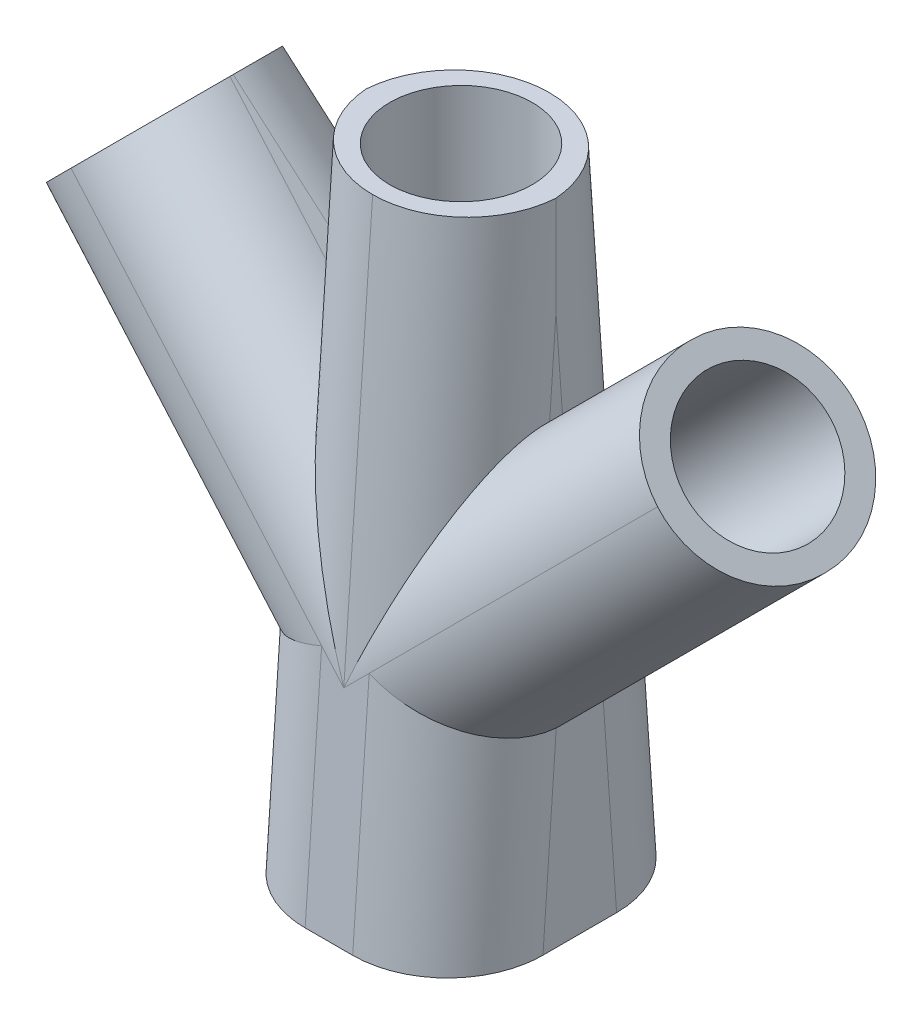
from build123d import *

# Parameters (mm, degrees)
EXTRUDE_618_DEPTH           = 12.5
SKETCH_4_R                  = 3.75
CUT_EXTRUDE_975_DEPTH       = 41.05700865176058
CUT_EXTRUDE_1125_REACH      = 47.49
CUT_EXTRUDE_1125_END_RADIUS = 3.75
SKETCH_5_R                  = 3.749999999999998
SKETCH_9_R                  = 5.25
CUT_EXTRUDE_1299_DEPTH      = 8
DRAFT_2_ANGLE               = 4.000000000000009
FILLET_8_R                  = 5


with BuildPart() as part:
    # Эскиз3 → Extrude 618 (new body)
    with BuildSketch(Plane.XY):
        Polygon((-6.249999999999994, 0), (-19.142135623730994, 12.892135623731), (-12.071067811865465, 19.963203435596466), (-5.000000000000028, 12.892135623730955), (-5.000000000000029, 22.892135623730955), (4.9999999999999964, 22.892135623730955), (5.000000000000001, 12.892135623730955), (12.071067811865465, 19.96320343559647), (19.142135623730994, 12.892135623731003), (6.249999999999991, 1.73e-15), (6.2499999999999964, -10.000000000000002), (-6.2499999999999885, -10.000000000000004), align=None)
    extrude(amount=EXTRUDE_618_DEPTH)

    # Эскиз4 → Cut-Extrude 975 (cut, through all)
    with BuildSketch(Plane(origin=(0, 22.892135623730955, 0), x_dir=(-1, 0, 0), z_dir=(0, 1, 0))):
        with Locations(Location((0, 6.25, 0), (0, 0, 90))):
            Circle(SKETCH_4_R)
    extrude(amount=-CUT_EXTRUDE_975_DEPTH, mode=Mode.SUBTRACT)

    # Cut-Extrude 1125: up to this cylinder (the profile starts outside it)
    cut_extrude_1125_end = Plane(origin=(0, 16.42767, 6.25), z_dir=(0, 1, 0)) * Cylinder(CUT_EXTRUDE_1125_END_RADIUS, 103.48, mode=Mode.PRIVATE)
    # Эскиз5 → Cut-Extrude 1125 (cut, up to the surface)
    with BuildSketch(Plane(origin=(-16.017135623730912, 16.01713562373106, 0), x_dir=(0, 0, 1), z_dir=(-0.707106781186544, 0.7071067811865511, 0)), mode=Mode.PRIVATE) as cut_extrude_1125_sk1:
        with Locations(Location((6.25, 0.5805826175839922, 0), (0, 0, 270))):
            Circle(SKETCH_5_R)
    cut_extrude_1125_tool1 = extrude(cut_extrude_1125_sk1.sketch, amount=-CUT_EXTRUDE_1125_REACH, mode=Mode.PRIVATE) - cut_extrude_1125_end
    cut_extrude_1125 = cut_extrude_1125_tool1.solids().sort_by_distance((-15.606602, 16.42767, 6.25))[0]
    add(cut_extrude_1125, mode=Mode.SUBTRACT)

    # Зеркальное отражение1: Cut-Extrude 1125 across plane
    add(cut_extrude_1125.mirror(Plane(origin=(0, 0, 0), x_dir=(0, 0, 1), z_dir=(1, 0, 0))), mode=Mode.SUBTRACT)

    # Эскиз9 → Cut-Extrude 1299 (cut)
    with BuildSketch(Plane.XZ.offset(10.000000000000004)):
        with Locations((-1.39e-15, 6.25)):
            Circle(SKETCH_9_R)
    extrude(amount=-CUT_EXTRUDE_1299_DEPTH, mode=Mode.SUBTRACT)

    # Уклон2
    draft_2_faces = [part.faces().sort_by_distance(p)[0] for p in [
        (-4.1e-16, 7.904291120407681, 0),
        (-4.1e-16, 7.904291120407681, 12.5),
    ]]
    draft(draft_2_faces, Plane.ZX, DRAFT_2_ANGLE)

    # Скругление8
    # the kernel refuses this fillet: 5 mm, written as the material it takes off along each edge
    with BuildSketch(Plane(origin=(-3.4028318124765566, 4.489303811254336, 0.313922703366867), x_dir=(0.707968543318461, -0.7045235927201029, -0.049265088777904954), z_dir=(0.7062439675293066, 0.7062439675293118, 0.04938538910366094))) as fillet_8_piece_1_section:
        with BuildLine():
            CenterArc((FILLET_8_R * 0.951833326591, -FILLET_8_R), FILLET_8_R, 90.00000000000001, 87.17272263971289)
            Line((-FILLET_8_R * 0.0469494411747, -FILLET_8_R * 0.950674724384), (-FILLET_8_R * 0.06692509653, -FILLET_8_R * 0.949688218872))
            Line((-FILLET_8_R * 0.06692509653, -FILLET_8_R * 0.949688218872), (-FILLET_8_R * 0.0190366665318, FILLET_8_R * 0.02))
            Line((-FILLET_8_R * 0.0190366665318, FILLET_8_R * 0.02), (FILLET_8_R * 0.951833326591, FILLET_8_R * 0.02))
            Line((FILLET_8_R * 0.951833326591, FILLET_8_R * 0.02), (FILLET_8_R * 0.951833326591, 0))
        make_face()
    fillet_8_piece_1 = extrude(amount=33.808050099667255, mode=Mode.PRIVATE)
    fillet_8_piece_1 = split(fillet_8_piece_1, bisect_by=Plane(origin=(12.895577990710061, 19.13869325675188, 2.0784184660423826), z_dir=(-0.7071067811865445, -0.7071067811865507, 0)), keep=Keep.TOP, mode=Mode.PRIVATE)
    fillet_8_piece_1 = split(fillet_8_piece_1, bisect_by=Plane(origin=(5, 15.19090426134115, 2.0784184660423826), z_dir=(1, 4.4e-16, 0)), keep=Keep.TOP, mode=Mode.PRIVATE)
    add(fillet_8_piece_1, mode=Mode.SUBTRACT)
    with BuildSketch(Plane(origin=(4.999999999999991, 35.36168625197875, 2.4727299845475397), x_dir=(-1, -4.4e-16, -1.3e-16), z_dir=(0, -0.9975640502598243, -0.06975647374412541))) as fillet_8_piece_2_section:
        with BuildLine():
            CenterArc((FILLET_8_R, -FILLET_8_R), FILLET_8_R, 89.99999999999999, 90.00000000000001)
            Line((-1.38e-15, -FILLET_8_R), (-FILLET_8_R * 0.02, -FILLET_8_R))
            Line((-FILLET_8_R * 0.02, -FILLET_8_R), (-FILLET_8_R * 0.02, FILLET_8_R * 0.02))
            Line((-FILLET_8_R * 0.02, FILLET_8_R * 0.02), (FILLET_8_R, FILLET_8_R * 0.02))
            Line((FILLET_8_R, FILLET_8_R * 0.02), (FILLET_8_R, 0))
        make_face()
    fillet_8_piece_2 = extrude(amount=35.02441898081172, mode=Mode.PRIVATE)
    fillet_8_piece_2 = split(fillet_8_piece_2, bisect_by=Plane(origin=(3.7636479953298396, 22.892135623730955, 2.280840284876604), z_dir=(0, -1, 0)), keep=Keep.TOP, mode=Mode.PRIVATE)
    fillet_8_piece_2 = split(fillet_8_piece_2, bisect_by=Plane(origin=(6.5727359964244485, 14.464871620155414, 2.280840284876604), z_dir=(-0.7071067811865501, 0.707106781186545, 0)), keep=Keep.TOP, mode=Mode.PRIVATE)
    add(fillet_8_piece_2, mode=Mode.SUBTRACT)
    with BuildSketch(Plane(origin=(-5.0000000000000275, 0.4225849954831524, 0.02955002150929953), x_dir=(1, 9e-17, 5e-17), z_dir=(0, 0.9975640502598243, 0.06975647374412541))) as fillet_8_piece_3_section:
        with BuildLine():
            CenterArc((FILLET_8_R, -FILLET_8_R), FILLET_8_R, 90, 90)
            Line((-6.5e-16, -FILLET_8_R), (-FILLET_8_R * 0.02, -FILLET_8_R))
            Line((-FILLET_8_R * 0.02, -FILLET_8_R), (-FILLET_8_R * 0.02, FILLET_8_R * 0.02))
            Line((-FILLET_8_R * 0.02, FILLET_8_R * 0.02), (FILLET_8_R, FILLET_8_R * 0.02))
            Line((FILLET_8_R, FILLET_8_R * 0.02), (FILLET_8_R, 0))
        make_face()
    fillet_8_piece_3 = extrude(amount=35.02441898081172, mode=Mode.PRIVATE)
    fillet_8_piece_3 = split(fillet_8_piece_3, bisect_by=Plane(origin=(-3.7636479953300457, 22.892135623730955, 2.280840284876456), z_dir=(0, -1, 0)), keep=Keep.TOP, mode=Mode.PRIVATE)
    fillet_8_piece_3 = split(fillet_8_piece_3, bisect_by=Plane(origin=(-6.572735996425691, 14.464871620156634, 2.280840284876456), z_dir=(0.7071067811865512, 0.7071067811865438, 0)), keep=Keep.TOP, mode=Mode.PRIVATE)
    add(fillet_8_piece_3, mode=Mode.SUBTRACT)
    with BuildSketch(Plane(origin=(-20.47389962434201, 28.366035248073096, 1.9835464123749982), x_dir=(-0.707968543318462, -0.7045235927201018, -0.04926508877790491), z_dir=(0.7062439675293055, -0.706243967529313, -0.04938538910366102))) as fillet_8_piece_4_section:
        with BuildLine():
            CenterArc((FILLET_8_R * 0.951833326591, -FILLET_8_R), FILLET_8_R, 90.00000000000001, 87.17272263971292)
            Line((-FILLET_8_R * 0.0469494411747, -FILLET_8_R * 0.950674724384), (-FILLET_8_R * 0.06692509653, -FILLET_8_R * 0.949688218872))
            Line((-FILLET_8_R * 0.06692509653, -FILLET_8_R * 0.949688218872), (-FILLET_8_R * 0.0190366665318, FILLET_8_R * 0.02))
            Line((-FILLET_8_R * 0.0190366665318, FILLET_8_R * 0.02), (FILLET_8_R * 0.951833326591, FILLET_8_R * 0.02))
            Line((FILLET_8_R * 0.951833326591, FILLET_8_R * 0.02), (FILLET_8_R * 0.951833326591, 1e-17))
        make_face()
    fillet_8_piece_4 = extrude(amount=33.808050099667234, mode=Mode.PRIVATE)
    fillet_8_piece_4 = split(fillet_8_piece_4, bisect_by=Plane(origin=(-12.895577990710212, 19.138693256751726, 2.0784184660426637), z_dir=(0.7071067811865444, -0.7071067811865508, 0)), keep=Keep.TOP, mode=Mode.PRIVATE)
    fillet_8_piece_4 = split(fillet_8_piece_4, bisect_by=Plane(origin=(-5.000000000000028, 15.190904261339226, 2.0784184660426637), z_dir=(-1, -9e-17, 0)), keep=Keep.TOP, mode=Mode.PRIVATE)
    add(fillet_8_piece_4, mode=Mode.SUBTRACT)
    with BuildSketch(Plane(origin=(3.024785140940291, -9.274785140940285, -0.6485561563669969), x_dir=(0.034920743526734764, -0.034920743526734764, 0.9987797972241329), z_dir=(-0.7062439675293093, 0.7062439675293093, 0.04938538910366077))) as fillet_8_piece_5_section:
        with BuildLine():
            CenterArc((FILLET_8_R * 1.0506041048, FILLET_8_R), FILLET_8_R, 177.17272263971293, 92.8272773602871)
            Line((FILLET_8_R * 0.0518213370326, FILLET_8_R * 1.04932527562), (FILLET_8_R * 0.0318456816773, FILLET_8_R * 1.05031178113))
            Line((FILLET_8_R * 0.0318456816773, FILLET_8_R * 1.05031178113), (-FILLET_8_R * 0.021012082096, -FILLET_8_R * 0.02))
            Line((-FILLET_8_R * 0.021012082096, -FILLET_8_R * 0.02), (FILLET_8_R * 1.0506041048, -FILLET_8_R * 0.02))
            Line((FILLET_8_R * 1.0506041048, -FILLET_8_R * 0.02), (FILLET_8_R * 1.0506041048, -1e-17))
        make_face()
    fillet_8_piece_5 = extrude(amount=44.519609867402835, mode=Mode.PRIVATE)
    fillet_8_piece_5 = split(fillet_8_piece_5, bisect_by=Plane(origin=(-6.249999999999998, 7.634264741233562, 1.7755717356560854), z_dir=(-1, -5.3e-16, 0)), keep=Keep.TOP, mode=Mode.PRIVATE)
    fillet_8_piece_5 = split(fillet_8_piece_5, bisect_by=Plane(origin=(-18.350004337442122, 13.684266910019865, 1.7755717356560854), z_dir=(0.7071067811865444, -0.7071067811865508, 0)), keep=Keep.TOP, mode=Mode.PRIVATE)
    add(fillet_8_piece_5, mode=Mode.SUBTRACT)
    with BuildSketch(Plane(origin=(-6.249999999999982, -22.469550628247802, -1.5712240412366727), x_dir=(0, -0.06975647374412541, 0.9975640502598242), z_dir=(0, 0.9975640502598243, 0.06975647374412541))) as fillet_8_piece_6_section:
        with BuildLine():
            CenterArc((FILLET_8_R, FILLET_8_R), FILLET_8_R, 180, 90)
            Line((0, FILLET_8_R), (-FILLET_8_R * 0.02, FILLET_8_R))
            Line((-FILLET_8_R * 0.02, FILLET_8_R), (-FILLET_8_R * 0.02, -FILLET_8_R * 0.02))
            Line((-FILLET_8_R * 0.02, -FILLET_8_R * 0.02), (FILLET_8_R, -FILLET_8_R * 0.02))
            Line((FILLET_8_R, -FILLET_8_R * 0.02), (FILLET_8_R, 0))
        make_face()
    fillet_8_piece_6 = extrude(amount=35.02441898081171, mode=Mode.PRIVATE)
    fillet_8_piece_6 = split(fillet_8_piece_6, bisect_by=Plane(origin=(-2.999285634158696, -3.2507143658412976, 0.8277016679449097), z_dir=(-0.7071067811865476, -0.7071067811865476, 0)), keep=Keep.TOP, mode=Mode.PRIVATE)
    fillet_8_piece_6 = split(fillet_8_piece_6, bisect_by=Plane(origin=(-5.249047512261576, -10.000000000000004, 0.8277016679449097), z_dir=(-1.4e-16, 1, 0)), keep=Keep.TOP, mode=Mode.PRIVATE)
    add(fillet_8_piece_6, mode=Mode.SUBTRACT)
    with BuildSketch(Plane(origin=(6.249999999999985, 12.469550628247795, 0.871955921801567), x_dir=(-1, -5.3e-16, -1e-16), z_dir=(0, -0.9975640502598243, -0.06975647374412541))) as fillet_8_piece_7_section:
        with BuildLine():
            CenterArc((FILLET_8_R, -FILLET_8_R), FILLET_8_R, 89.99999999999999, 90.00000000000001)
            Line((-1.19e-15, -FILLET_8_R), (-FILLET_8_R * 0.02, -FILLET_8_R))
            Line((-FILLET_8_R * 0.02, -FILLET_8_R), (-FILLET_8_R * 0.02, FILLET_8_R * 0.02))
            Line((-FILLET_8_R * 0.02, FILLET_8_R * 0.02), (FILLET_8_R, FILLET_8_R * 0.02))
            Line((FILLET_8_R, FILLET_8_R * 0.02), (FILLET_8_R, 0))
        make_face()
    fillet_8_piece_7 = extrude(amount=35.02441898081172, mode=Mode.PRIVATE)
    fillet_8_piece_7 = split(fillet_8_piece_7, bisect_by=Plane(origin=(5.249047512262002, -10.000000000000002, 0.8277016679442836), z_dir=(-1.4e-16, 1, 0)), keep=Keep.TOP, mode=Mode.PRIVATE)
    fillet_8_piece_7 = split(fillet_8_piece_7, bisect_by=Plane(origin=(2.9992856341578893, -3.250714365842102, 0.8277016679442836), z_dir=(0.7071067811865476, -0.7071067811865476, 0)), keep=Keep.TOP, mode=Mode.PRIVATE)
    add(fillet_8_piece_7, mode=Mode.SUBTRACT)
    with BuildSketch(Plane(origin=(28.416920764671282, 22.16692076467129, 1.5500620996778676), x_dir=(-0.7079685433184584, 0.7045235927201055, 0.04926508877790521), z_dir=(-0.7062439675293093, -0.7062439675293093, -0.04938538910366077))) as fillet_8_piece_8_section:
        with BuildLine():
            CenterArc((FILLET_8_R * 1.0506041048, -FILLET_8_R), FILLET_8_R, 90, 92.8272773602871)
            Line((FILLET_8_R * 0.0518213370326, -FILLET_8_R * 1.04932527562), (FILLET_8_R * 0.0318456816773, -FILLET_8_R * 1.05031178113))
            Line((FILLET_8_R * 0.0318456816773, -FILLET_8_R * 1.05031178113), (-FILLET_8_R * 0.021012082096, FILLET_8_R * 0.02))
            Line((-FILLET_8_R * 0.021012082096, FILLET_8_R * 0.02), (FILLET_8_R * 1.0506041048, FILLET_8_R * 0.02))
            Line((FILLET_8_R * 1.0506041048, FILLET_8_R * 0.02), (FILLET_8_R * 1.0506041048, 1e-17))
        make_face()
    fillet_8_piece_8 = extrude(amount=44.519609867402856, mode=Mode.PRIVATE)
    fillet_8_piece_8 = split(fillet_8_piece_8, bisect_by=Plane(origin=(18.350004337441796, 13.684266910020192, 1.7755717356563456), z_dir=(-0.7071067811865445, -0.7071067811865507, 0)), keep=Keep.TOP, mode=Mode.PRIVATE)
    fillet_8_piece_8 = split(fillet_8_piece_8, bisect_by=Plane(origin=(6.249999999999987, 7.634264741230422, 1.7755717356563456), z_dir=(1, 5.3e-16, 0)), keep=Keep.TOP, mode=Mode.PRIVATE)
    add(fillet_8_piece_8, mode=Mode.SUBTRACT)
    with BuildSketch(Plane(origin=(-6.249999999999982, -22.469550628247813, 14.071224041236674), x_dir=(0, -0.06975647374412541, -0.9975640502598242), z_dir=(0, 0.9975640502598243, -0.06975647374412541))) as fillet_8_piece_9_section:
        with BuildLine():
            CenterArc((FILLET_8_R, -FILLET_8_R), FILLET_8_R, 90.00000000000001, 89.99999999999999)
            Line((6.4e-16, -FILLET_8_R), (-FILLET_8_R * 0.02, -FILLET_8_R))
            Line((-FILLET_8_R * 0.02, -FILLET_8_R), (-FILLET_8_R * 0.02, FILLET_8_R * 0.02))
            Line((-FILLET_8_R * 0.02, FILLET_8_R * 0.02), (FILLET_8_R, FILLET_8_R * 0.02))
            Line((FILLET_8_R, FILLET_8_R * 0.02), (FILLET_8_R, 0))
        make_face()
    fillet_8_piece_9 = extrude(amount=35.02441898081173, mode=Mode.PRIVATE)
    fillet_8_piece_9 = split(fillet_8_piece_9, bisect_by=Plane(origin=(-2.9992856341583285, -3.2507143658416653, 11.672298332055412), z_dir=(-0.7071067811865476, -0.7071067811865476, 0)), keep=Keep.TOP, mode=Mode.PRIVATE)
    fillet_8_piece_9 = split(fillet_8_piece_9, bisect_by=Plane(origin=(-5.249047512261512, -10.000000000000004, 11.672298332055412), z_dir=(-1.4e-16, 1, 0)), keep=Keep.TOP, mode=Mode.PRIVATE)
    add(fillet_8_piece_9, mode=Mode.SUBTRACT)
    with BuildSketch(Plane(origin=(6.249999999999985, 12.469550628247802, 11.628044078198434), x_dir=(-1, -5.3e-16, -1e-17), z_dir=(0, -0.9975640502598243, 0.06975647374412541))) as fillet_8_piece_10_section:
        with BuildLine():
            CenterArc((FILLET_8_R, FILLET_8_R), FILLET_8_R, 180, 90)
            Line((-6.4e-16, FILLET_8_R), (-FILLET_8_R * 0.02, FILLET_8_R))
            Line((-FILLET_8_R * 0.02, FILLET_8_R), (-FILLET_8_R * 0.02, -FILLET_8_R * 0.02))
            Line((-FILLET_8_R * 0.02, -FILLET_8_R * 0.02), (FILLET_8_R, -FILLET_8_R * 0.02))
            Line((FILLET_8_R, -FILLET_8_R * 0.02), (FILLET_8_R, 0))
        make_face()
    fillet_8_piece_10 = extrude(amount=35.02441898081173, mode=Mode.PRIVATE)
    fillet_8_piece_10 = split(fillet_8_piece_10, bisect_by=Plane(origin=(5.2490475122620985, -10.000000000000002, 11.672298332055796), z_dir=(-1.4e-16, 1, 0)), keep=Keep.TOP, mode=Mode.PRIVATE)
    fillet_8_piece_10 = split(fillet_8_piece_10, bisect_by=Plane(origin=(2.9992856341578964, -3.2507143658420947, 11.672298332055796), z_dir=(0.7071067811865476, -0.7071067811865476, 0)), keep=Keep.TOP, mode=Mode.PRIVATE)
    add(fillet_8_piece_10, mode=Mode.SUBTRACT)
    with BuildSketch(Plane(origin=(28.41692076467128, 22.16692076467129, 10.949937900322134), x_dir=(-0.7079685433184584, 0.7045235927201055, -0.049265088777905426), z_dir=(-0.7062439675293093, -0.7062439675293093, 0.04938538910366077))) as fillet_8_piece_11_section:
        with BuildLine():
            CenterArc((FILLET_8_R * 1.0506041048, FILLET_8_R), FILLET_8_R, 177.1727226397129, 92.8272773602871)
            Line((FILLET_8_R * 0.0518213370326, FILLET_8_R * 1.04932527562), (FILLET_8_R * 0.0318456816773, FILLET_8_R * 1.05031178113))
            Line((FILLET_8_R * 0.0318456816773, FILLET_8_R * 1.05031178113), (-FILLET_8_R * 0.021012082096, -FILLET_8_R * 0.02))
            Line((-FILLET_8_R * 0.021012082096, -FILLET_8_R * 0.02), (FILLET_8_R * 1.0506041048, -FILLET_8_R * 0.02))
            Line((FILLET_8_R * 1.0506041048, -FILLET_8_R * 0.02), (FILLET_8_R * 1.0506041048, -1e-17))
        make_face()
    fillet_8_piece_11 = extrude(amount=44.51960986740285, mode=Mode.PRIVATE)
    fillet_8_piece_11 = split(fillet_8_piece_11, bisect_by=Plane(origin=(18.35000433744206, 13.68426691001993, 10.724428264343876), z_dir=(-0.7071067811865445, -0.7071067811865507, 0)), keep=Keep.TOP, mode=Mode.PRIVATE)
    fillet_8_piece_11 = split(fillet_8_piece_11, bisect_by=Plane(origin=(6.249999999999987, 7.63426474123258, 10.724428264343876), z_dir=(1, 5.3e-16, 0)), keep=Keep.TOP, mode=Mode.PRIVATE)
    add(fillet_8_piece_11, mode=Mode.SUBTRACT)
    with BuildSketch(Plane(origin=(-3.402831812476554, 4.489303811254339, 12.186077296633133), x_dir=(0.707968543318461, -0.7045235927201029, 0.04926508877790491), z_dir=(0.7062439675293066, 0.7062439675293118, -0.04938538910366094))) as fillet_8_piece_12_section:
        with BuildLine():
            CenterArc((FILLET_8_R * 0.951833326591, FILLET_8_R), FILLET_8_R, 182.8272773602871, 87.1727226397129)
            Line((-FILLET_8_R * 0.0469494411747, FILLET_8_R * 0.950674724384), (-FILLET_8_R * 0.06692509653, FILLET_8_R * 0.949688218872))
            Line((-FILLET_8_R * 0.06692509653, FILLET_8_R * 0.949688218872), (-FILLET_8_R * 0.0190366665318, -FILLET_8_R * 0.02))
            Line((-FILLET_8_R * 0.0190366665318, -FILLET_8_R * 0.02), (FILLET_8_R * 0.951833326591, -FILLET_8_R * 0.02))
            Line((FILLET_8_R * 0.951833326591, -FILLET_8_R * 0.02), (FILLET_8_R * 0.951833326591, -3e-17))
        make_face()
    fillet_8_piece_12 = extrude(amount=33.808050099667255, mode=Mode.PRIVATE)
    fillet_8_piece_12 = split(fillet_8_piece_12, bisect_by=Plane(origin=(12.895577990710052, 19.13869325675189, 10.421581533957658), z_dir=(-0.7071067811865445, -0.7071067811865507, 0)), keep=Keep.TOP, mode=Mode.PRIVATE)
    fillet_8_piece_12 = split(fillet_8_piece_12, bisect_by=Plane(origin=(5, 15.190904261341167, 10.421581533957658), z_dir=(1, 4.4e-16, 0)), keep=Keep.TOP, mode=Mode.PRIVATE)
    add(fillet_8_piece_12, mode=Mode.SUBTRACT)
    with BuildSketch(Plane(origin=(4.999999999999991, 35.36168625197876, 10.02727001545246), x_dir=(-1, -4.4e-16, 1.3e-16), z_dir=(0, -0.9975640502598243, 0.06975647374412541))) as fillet_8_piece_13_section:
        with BuildLine():
            CenterArc((FILLET_8_R, FILLET_8_R), FILLET_8_R, 180, 90)
            Line((-1.38e-15, FILLET_8_R), (-FILLET_8_R * 0.02, FILLET_8_R))
            Line((-FILLET_8_R * 0.02, FILLET_8_R), (-FILLET_8_R * 0.02, -FILLET_8_R * 0.02))
            Line((-FILLET_8_R * 0.02, -FILLET_8_R * 0.02), (FILLET_8_R, -FILLET_8_R * 0.02))
            Line((FILLET_8_R, -FILLET_8_R * 0.02), (FILLET_8_R, 0))
        make_face()
    fillet_8_piece_13 = extrude(amount=35.024418980811724, mode=Mode.PRIVATE)
    fillet_8_piece_13 = split(fillet_8_piece_13, bisect_by=Plane(origin=(3.7636479953302784, 22.892135623730955, 10.219159715123435), z_dir=(0, -1, 0)), keep=Keep.TOP, mode=Mode.PRIVATE)
    fillet_8_piece_13 = split(fillet_8_piece_13, bisect_by=Plane(origin=(6.572735996426328, 14.464871620157293, 10.219159715123435), z_dir=(-0.7071067811865501, 0.707106781186545, 0)), keep=Keep.TOP, mode=Mode.PRIVATE)
    add(fillet_8_piece_13, mode=Mode.SUBTRACT)
    with BuildSketch(Plane(origin=(-5.0000000000000275, 0.4225849954831524, 12.4704499784907), x_dir=(1, 9e-17, -3e-17), z_dir=(0, 0.9975640502598243, -0.06975647374412541))) as fillet_8_piece_14_section:
        with BuildLine():
            CenterArc((FILLET_8_R, FILLET_8_R), FILLET_8_R, 180, 90)
            Line((-7.6e-16, FILLET_8_R), (-FILLET_8_R * 0.02, FILLET_8_R))
            Line((-FILLET_8_R * 0.02, FILLET_8_R), (-FILLET_8_R * 0.02, -FILLET_8_R * 0.02))
            Line((-FILLET_8_R * 0.02, -FILLET_8_R * 0.02), (FILLET_8_R, -FILLET_8_R * 0.02))
            Line((FILLET_8_R, -FILLET_8_R * 0.02), (FILLET_8_R, 0))
        make_face()
    fillet_8_piece_14 = extrude(amount=35.02441898081172, mode=Mode.PRIVATE)
    fillet_8_piece_14 = split(fillet_8_piece_14, bisect_by=Plane(origin=(-3.7636479953302375, 22.892135623730955, 10.21915971512358), z_dir=(0, -1, 0)), keep=Keep.TOP, mode=Mode.PRIVATE)
    fillet_8_piece_14 = split(fillet_8_piece_14, bisect_by=Plane(origin=(-6.572735996426481, 14.464871620157425, 10.21915971512358), z_dir=(0.7071067811865512, 0.7071067811865438, 0)), keep=Keep.TOP, mode=Mode.PRIVATE)
    add(fillet_8_piece_14, mode=Mode.SUBTRACT)
    with BuildSketch(Plane(origin=(-20.47389962434201, 28.366035248073096, 10.516453587625001), x_dir=(-0.7079685433184622, -0.7045235927201017, 0.04926508877790538), z_dir=(0.7062439675293055, -0.706243967529313, 0.04938538910366102))) as fillet_8_piece_15_section:
        with BuildLine():
            CenterArc((FILLET_8_R * 0.951833326591, FILLET_8_R), FILLET_8_R, 182.8272773602871, 87.1727226397129)
            Line((-FILLET_8_R * 0.0469494411747, FILLET_8_R * 0.950674724384), (-FILLET_8_R * 0.06692509653, FILLET_8_R * 0.949688218872))
            Line((-FILLET_8_R * 0.06692509653, FILLET_8_R * 0.949688218872), (-FILLET_8_R * 0.0190366665318, -FILLET_8_R * 0.02))
            Line((-FILLET_8_R * 0.0190366665318, -FILLET_8_R * 0.02), (FILLET_8_R * 0.951833326591, -FILLET_8_R * 0.02))
            Line((FILLET_8_R * 0.951833326591, -FILLET_8_R * 0.02), (FILLET_8_R * 0.951833326591, 5e-17))
        make_face()
    fillet_8_piece_15 = extrude(amount=33.808050099667234, mode=Mode.PRIVATE)
    fillet_8_piece_15 = split(fillet_8_piece_15, bisect_by=Plane(origin=(-12.895577990710136, 19.1386932567518, 10.421581533957545), z_dir=(0.7071067811865444, -0.7071067811865508, 0)), keep=Keep.TOP, mode=Mode.PRIVATE)
    fillet_8_piece_15 = split(fillet_8_piece_15, bisect_by=Plane(origin=(-5.000000000000028, 15.190904261340359, 10.421581533957545), z_dir=(-1, -9e-17, 0)), keep=Keep.TOP, mode=Mode.PRIVATE)
    add(fillet_8_piece_15, mode=Mode.SUBTRACT)
    with BuildSketch(Plane(origin=(3.024785140940291, -9.274785140940285, 13.148556156366999), x_dir=(0.034920743526734764, -0.034920743526734764, -0.9987797972241329), z_dir=(-0.7062439675293093, 0.7062439675293093, -0.04938538910366077))) as fillet_8_piece_16_section:
        with BuildLine():
            CenterArc((FILLET_8_R * 1.0506041048, -FILLET_8_R), FILLET_8_R, 90, 92.8272773602871)
            Line((FILLET_8_R * 0.0518213370326, -FILLET_8_R * 1.04932527562), (FILLET_8_R * 0.0318456816773, -FILLET_8_R * 1.05031178113))
            Line((FILLET_8_R * 0.0318456816773, -FILLET_8_R * 1.05031178113), (-FILLET_8_R * 0.021012082096, FILLET_8_R * 0.02))
            Line((-FILLET_8_R * 0.021012082096, FILLET_8_R * 0.02), (FILLET_8_R * 1.0506041048, FILLET_8_R * 0.02))
            Line((FILLET_8_R * 1.0506041048, FILLET_8_R * 0.02), (FILLET_8_R * 1.0506041048, 1e-17))
        make_face()
    fillet_8_piece_16 = extrude(amount=44.51960986740285, mode=Mode.PRIVATE)
    fillet_8_piece_16 = split(fillet_8_piece_16, bisect_by=Plane(origin=(-6.249999999999998, 7.634264741233135, 10.72442826434399), z_dir=(-1, -5.3e-16, 0)), keep=Keep.TOP, mode=Mode.PRIVATE)
    fillet_8_piece_16 = split(fillet_8_piece_16, bisect_by=Plane(origin=(-18.350004337442037, 13.68426691001995, 10.72442826434399), z_dir=(0.7071067811865444, -0.7071067811865508, 0)), keep=Keep.TOP, mode=Mode.PRIVATE)
    add(fillet_8_piece_16, mode=Mode.SUBTRACT)
    with BuildSketch(Plane(origin=(4.999999999999991, 35.36168625197875, 2.4727299845475397), x_dir=(-1, -4.4e-16, -1.3e-16), z_dir=(0, -0.9975640502598243, -0.06975647374412541))) as fillet_8_piece_17a_section:
        with BuildLine():
            CenterArc((FILLET_8_R, -FILLET_8_R), FILLET_8_R, 89.99999999999999, 90.00000000000001)
            Line((-1.38e-15, -FILLET_8_R), (-FILLET_8_R * 0.02, -FILLET_8_R))
            Line((-FILLET_8_R * 0.02, -FILLET_8_R), (-FILLET_8_R * 0.02, FILLET_8_R * 0.02))
            Line((-FILLET_8_R * 0.02, FILLET_8_R * 0.02), (FILLET_8_R, FILLET_8_R * 0.02))
            Line((FILLET_8_R, FILLET_8_R * 0.02), (FILLET_8_R, 0))
        make_face()
    fillet_8_piece_17a = extrude(amount=35.02441898081172, mode=Mode.PRIVATE)
    fillet_8_piece_17a = split(fillet_8_piece_17a, bisect_by=Plane(origin=(1.092194353831831, 8.984329977562757, 1.6288587466862252), z_dir=(0.7071067811865501, -0.707106781186545, 0)), keep=Keep.TOP, mode=Mode.PRIVATE)
    with BuildSketch(Plane(origin=(-3.4028318124765566, 4.489303811254336, 0.313922703366867), x_dir=(0.707968543318461, -0.7045235927201029, -0.049265088777904954), z_dir=(0.7062439675293066, 0.7062439675293118, 0.04938538910366094))) as fillet_8_piece_17b_section:
        with BuildLine():
            CenterArc((FILLET_8_R * 0.951833326591, -FILLET_8_R), FILLET_8_R, 90.00000000000001, 87.17272263971289)
            Line((-FILLET_8_R * 0.0469494411747, -FILLET_8_R * 0.950674724384), (-FILLET_8_R * 0.06692509653, -FILLET_8_R * 0.949688218872))
            Line((-FILLET_8_R * 0.06692509653, -FILLET_8_R * 0.949688218872), (-FILLET_8_R * 0.0190366665318, FILLET_8_R * 0.02))
            Line((-FILLET_8_R * 0.0190366665318, FILLET_8_R * 0.02), (FILLET_8_R * 0.951833326591, FILLET_8_R * 0.02))
            Line((FILLET_8_R * 0.951833326591, FILLET_8_R * 0.02), (FILLET_8_R * 0.951833326591, 0))
        make_face()
    fillet_8_piece_17b = extrude(amount=33.808050099667255, mode=Mode.PRIVATE)
    fillet_8_piece_17b = split(fillet_8_piece_17b, bisect_by=Plane(origin=(5.0000000000000036, 7.643322173814759, 1.6701485423468212), z_dir=(-1, -4.4e-16, 0)), keep=Keep.TOP, mode=Mode.PRIVATE)
    fillet_8_piece_17 = fillet_8_piece_17a & fillet_8_piece_17b
    add(fillet_8_piece_17, mode=Mode.SUBTRACT)
    with BuildSketch(Plane(origin=(-20.47389962434201, 28.366035248073096, 1.9835464123749982), x_dir=(-0.707968543318462, -0.7045235927201018, -0.04926508877790491), z_dir=(0.7062439675293055, -0.706243967529313, -0.04938538910366102))) as fillet_8_piece_18a_section:
        with BuildLine():
            CenterArc((FILLET_8_R * 0.951833326591, -FILLET_8_R), FILLET_8_R, 90.00000000000001, 87.17272263971292)
            Line((-FILLET_8_R * 0.0469494411747, -FILLET_8_R * 0.950674724384), (-FILLET_8_R * 0.06692509653, -FILLET_8_R * 0.949688218872))
            Line((-FILLET_8_R * 0.06692509653, -FILLET_8_R * 0.949688218872), (-FILLET_8_R * 0.0190366665318, FILLET_8_R * 0.02))
            Line((-FILLET_8_R * 0.0190366665318, FILLET_8_R * 0.02), (FILLET_8_R * 0.951833326591, FILLET_8_R * 0.02))
            Line((FILLET_8_R * 0.951833326591, FILLET_8_R * 0.02), (FILLET_8_R * 0.951833326591, 1e-17))
        make_face()
    fillet_8_piece_18a = extrude(amount=33.808050099667234, mode=Mode.PRIVATE)
    fillet_8_piece_18a = split(fillet_8_piece_18a, bisect_by=Plane(origin=(-5.0000000000000275, 7.643322173813422, 1.6701485423463631), z_dir=(1, 9e-17, 0)), keep=Keep.TOP, mode=Mode.PRIVATE)
    with BuildSketch(Plane(origin=(-5.0000000000000275, 0.4225849954831524, 0.02955002150929953), x_dir=(1, 9e-17, 5e-17), z_dir=(0, 0.9975640502598243, 0.06975647374412541))) as fillet_8_piece_18b_section:
        with BuildLine():
            CenterArc((FILLET_8_R, -FILLET_8_R), FILLET_8_R, 90, 90)
            Line((-6.5e-16, -FILLET_8_R), (-FILLET_8_R * 0.02, -FILLET_8_R))
            Line((-FILLET_8_R * 0.02, -FILLET_8_R), (-FILLET_8_R * 0.02, FILLET_8_R * 0.02))
            Line((-FILLET_8_R * 0.02, FILLET_8_R * 0.02), (FILLET_8_R, FILLET_8_R * 0.02))
            Line((FILLET_8_R, FILLET_8_R * 0.02), (FILLET_8_R, 0))
        make_face()
    fillet_8_piece_18b = extrude(amount=35.02441898081172, mode=Mode.PRIVATE)
    fillet_8_piece_18b = split(fillet_8_piece_18b, bisect_by=Plane(origin=(-1.092194353832559, 8.984329977563444, 1.6288587466865896), z_dir=(-0.7071067811865512, -0.7071067811865438, 0)), keep=Keep.TOP, mode=Mode.PRIVATE)
    fillet_8_piece_18 = fillet_8_piece_18a & fillet_8_piece_18b
    add(fillet_8_piece_18, mode=Mode.SUBTRACT)
    with BuildSketch(Plane(origin=(3.024785140940291, -9.274785140940285, -0.6485561563669969), x_dir=(0.034920743526734764, -0.034920743526734764, 0.9987797972241329), z_dir=(-0.7062439675293093, 0.7062439675293093, 0.04938538910366077))) as fillet_8_piece_19a_section:
        with BuildLine():
            CenterArc((FILLET_8_R * 1.0506041048, FILLET_8_R), FILLET_8_R, 177.17272263971293, 92.8272773602871)
            Line((FILLET_8_R * 0.0518213370326, FILLET_8_R * 1.04932527562), (FILLET_8_R * 0.0318456816773, FILLET_8_R * 1.05031178113))
            Line((FILLET_8_R * 0.0318456816773, FILLET_8_R * 1.05031178113), (-FILLET_8_R * 0.021012082096, -FILLET_8_R * 0.02))
            Line((-FILLET_8_R * 0.021012082096, -FILLET_8_R * 0.02), (FILLET_8_R * 1.0506041048, -FILLET_8_R * 0.02))
            Line((FILLET_8_R * 1.0506041048, -FILLET_8_R * 0.02), (FILLET_8_R * 1.0506041048, -1e-17))
        make_face()
    fillet_8_piece_19a = extrude(amount=44.519609867402835, mode=Mode.PRIVATE)
    fillet_8_piece_19a = split(fillet_8_piece_19a, bisect_by=Plane(origin=(-6.249999999999992, -3.300210825762088, 0.9188548035940711), z_dir=(1, 5.3e-16, 0)), keep=Keep.TOP, mode=Mode.PRIVATE)
    with BuildSketch(Plane(origin=(-6.249999999999982, -22.469550628247802, -1.5712240412366727), x_dir=(0, -0.06975647374412541, 0.9975640502598242), z_dir=(0, 0.9975640502598243, 0.06975647374412541))) as fillet_8_piece_19b_section:
        with BuildLine():
            CenterArc((FILLET_8_R, FILLET_8_R), FILLET_8_R, 180, 90)
            Line((0, FILLET_8_R), (-FILLET_8_R * 0.02, FILLET_8_R))
            Line((-FILLET_8_R * 0.02, FILLET_8_R), (-FILLET_8_R * 0.02, -FILLET_8_R * 0.02))
            Line((-FILLET_8_R * 0.02, -FILLET_8_R * 0.02), (FILLET_8_R, -FILLET_8_R * 0.02))
            Line((FILLET_8_R, -FILLET_8_R * 0.02), (FILLET_8_R, 0))
        make_face()
    fillet_8_piece_19b = extrude(amount=35.02441898081171, mode=Mode.PRIVATE)
    fillet_8_piece_19b = split(fillet_8_piece_19b, bisect_by=Plane(origin=(-8.43255622230143, 2.182556222301437, 1.4684963120997898), z_dir=(0.7071067811865476, 0.7071067811865476, 0)), keep=Keep.TOP, mode=Mode.PRIVATE)
    fillet_8_piece_19 = fillet_8_piece_19a & fillet_8_piece_19b
    add(fillet_8_piece_19, mode=Mode.SUBTRACT)
    with BuildSketch(Plane(origin=(28.416920764671282, 22.16692076467129, 1.5500620996778676), x_dir=(-0.7079685433184584, 0.7045235927201055, 0.04926508877790521), z_dir=(-0.7062439675293093, -0.7062439675293093, -0.04938538910366077))) as fillet_8_piece_20a_section:
        with BuildLine():
            CenterArc((FILLET_8_R * 1.0506041048, -FILLET_8_R), FILLET_8_R, 90, 92.8272773602871)
            Line((FILLET_8_R * 0.0518213370326, -FILLET_8_R * 1.04932527562), (FILLET_8_R * 0.0318456816773, -FILLET_8_R * 1.05031178113))
            Line((FILLET_8_R * 0.0318456816773, -FILLET_8_R * 1.05031178113), (-FILLET_8_R * 0.021012082096, FILLET_8_R * 0.02))
            Line((-FILLET_8_R * 0.021012082096, FILLET_8_R * 0.02), (FILLET_8_R * 1.0506041048, FILLET_8_R * 0.02))
            Line((FILLET_8_R * 1.0506041048, FILLET_8_R * 0.02), (FILLET_8_R * 1.0506041048, 1e-17))
        make_face()
    fillet_8_piece_20a = extrude(amount=44.519609867402856, mode=Mode.PRIVATE)
    fillet_8_piece_20a = split(fillet_8_piece_20a, bisect_by=Plane(origin=(6.249999999999993, -3.3002108257669858, 0.91885480359322), z_dir=(-1, -5.3e-16, 0)), keep=Keep.TOP, mode=Mode.PRIVATE)
    with BuildSketch(Plane(origin=(6.249999999999985, 12.469550628247795, 0.871955921801567), x_dir=(-1, -5.3e-16, -1e-16), z_dir=(0, -0.9975640502598243, -0.06975647374412541))) as fillet_8_piece_20b_section:
        with BuildLine():
            CenterArc((FILLET_8_R, -FILLET_8_R), FILLET_8_R, 89.99999999999999, 90.00000000000001)
            Line((-1.19e-15, -FILLET_8_R), (-FILLET_8_R * 0.02, -FILLET_8_R))
            Line((-FILLET_8_R * 0.02, -FILLET_8_R), (-FILLET_8_R * 0.02, FILLET_8_R * 0.02))
            Line((-FILLET_8_R * 0.02, FILLET_8_R * 0.02), (FILLET_8_R, FILLET_8_R * 0.02))
            Line((FILLET_8_R, FILLET_8_R * 0.02), (FILLET_8_R, 0))
        make_face()
    fillet_8_piece_20b = extrude(amount=35.02441898081172, mode=Mode.PRIVATE)
    fillet_8_piece_20b = split(fillet_8_piece_20b, bisect_by=Plane(origin=(8.432556222300084, 2.182556222300093, 1.4684963120999766), z_dir=(-0.7071067811865476, 0.7071067811865476, 0)), keep=Keep.TOP, mode=Mode.PRIVATE)
    fillet_8_piece_20 = fillet_8_piece_20a & fillet_8_piece_20b
    add(fillet_8_piece_20, mode=Mode.SUBTRACT)
    with BuildSketch(Plane(origin=(3.024785140940291, -9.274785140940285, 13.148556156366999), x_dir=(0.034920743526734764, -0.034920743526734764, -0.9987797972241329), z_dir=(-0.7062439675293093, 0.7062439675293093, -0.04938538910366077))) as fillet_8_piece_21a_section:
        with BuildLine():
            CenterArc((FILLET_8_R * 1.0506041048, -FILLET_8_R), FILLET_8_R, 90, 92.8272773602871)
            Line((FILLET_8_R * 0.0518213370326, -FILLET_8_R * 1.04932527562), (FILLET_8_R * 0.0318456816773, -FILLET_8_R * 1.05031178113))
            Line((FILLET_8_R * 0.0318456816773, -FILLET_8_R * 1.05031178113), (-FILLET_8_R * 0.021012082096, FILLET_8_R * 0.02))
            Line((-FILLET_8_R * 0.021012082096, FILLET_8_R * 0.02), (FILLET_8_R * 1.0506041048, FILLET_8_R * 0.02))
            Line((FILLET_8_R * 1.0506041048, FILLET_8_R * 0.02), (FILLET_8_R * 1.0506041048, 1e-17))
        make_face()
    fillet_8_piece_21a = extrude(amount=44.51960986740285, mode=Mode.PRIVATE)
    fillet_8_piece_21a = split(fillet_8_piece_21a, bisect_by=Plane(origin=(-6.249999999999992, -3.300210825762769, 11.581145196405938), z_dir=(1, 5.3e-16, 0)), keep=Keep.TOP, mode=Mode.PRIVATE)
    with BuildSketch(Plane(origin=(-6.249999999999982, -22.469550628247813, 14.071224041236674), x_dir=(0, -0.06975647374412541, -0.9975640502598242), z_dir=(0, 0.9975640502598243, -0.06975647374412541))) as fillet_8_piece_21b_section:
        with BuildLine():
            CenterArc((FILLET_8_R, -FILLET_8_R), FILLET_8_R, 90.00000000000001, 89.99999999999999)
            Line((6.4e-16, -FILLET_8_R), (-FILLET_8_R * 0.02, -FILLET_8_R))
            Line((-FILLET_8_R * 0.02, -FILLET_8_R), (-FILLET_8_R * 0.02, FILLET_8_R * 0.02))
            Line((-FILLET_8_R * 0.02, FILLET_8_R * 0.02), (FILLET_8_R, FILLET_8_R * 0.02))
            Line((FILLET_8_R, FILLET_8_R * 0.02), (FILLET_8_R, 0))
        make_face()
    fillet_8_piece_21b = extrude(amount=35.02441898081173, mode=Mode.PRIVATE)
    fillet_8_piece_21b = split(fillet_8_piece_21b, bisect_by=Plane(origin=(-8.432556222301223, 2.18255622230123, 11.031503687900047), z_dir=(0.7071067811865476, 0.7071067811865476, 0)), keep=Keep.TOP, mode=Mode.PRIVATE)
    fillet_8_piece_21 = fillet_8_piece_21a & fillet_8_piece_21b
    add(fillet_8_piece_21, mode=Mode.SUBTRACT)
    with BuildSketch(Plane(origin=(28.41692076467128, 22.16692076467129, 10.949937900322134), x_dir=(-0.7079685433184584, 0.7045235927201055, -0.049265088777905426), z_dir=(-0.7062439675293093, -0.7062439675293093, 0.04938538910366077))) as fillet_8_piece_22a_section:
        with BuildLine():
            CenterArc((FILLET_8_R * 1.0506041048, FILLET_8_R), FILLET_8_R, 177.1727226397129, 92.8272773602871)
            Line((FILLET_8_R * 0.0518213370326, FILLET_8_R * 1.04932527562), (FILLET_8_R * 0.0318456816773, FILLET_8_R * 1.05031178113))
            Line((FILLET_8_R * 0.0318456816773, FILLET_8_R * 1.05031178113), (-FILLET_8_R * 0.021012082096, -FILLET_8_R * 0.02))
            Line((-FILLET_8_R * 0.021012082096, -FILLET_8_R * 0.02), (FILLET_8_R * 1.0506041048, -FILLET_8_R * 0.02))
            Line((FILLET_8_R * 1.0506041048, -FILLET_8_R * 0.02), (FILLET_8_R * 1.0506041048, -1e-17))
        make_face()
    fillet_8_piece_22a = extrude(amount=44.51960986740285, mode=Mode.PRIVATE)
    fillet_8_piece_22a = split(fillet_8_piece_22a, bisect_by=Plane(origin=(6.249999999999993, -3.300210825763908, 11.581145196406068), z_dir=(-1, -5.3e-16, 0)), keep=Keep.TOP, mode=Mode.PRIVATE)
    with BuildSketch(Plane(origin=(6.249999999999985, 12.469550628247802, 11.628044078198434), x_dir=(-1, -5.3e-16, -1e-17), z_dir=(0, -0.9975640502598243, 0.06975647374412541))) as fillet_8_piece_22b_section:
        with BuildLine():
            CenterArc((FILLET_8_R, FILLET_8_R), FILLET_8_R, 180, 90)
            Line((-6.4e-16, FILLET_8_R), (-FILLET_8_R * 0.02, FILLET_8_R))
            Line((-FILLET_8_R * 0.02, FILLET_8_R), (-FILLET_8_R * 0.02, -FILLET_8_R * 0.02))
            Line((-FILLET_8_R * 0.02, -FILLET_8_R * 0.02), (FILLET_8_R, -FILLET_8_R * 0.02))
            Line((FILLET_8_R, -FILLET_8_R * 0.02), (FILLET_8_R, 0))
        make_face()
    fillet_8_piece_22b = extrude(amount=35.02441898081173, mode=Mode.PRIVATE)
    fillet_8_piece_22b = split(fillet_8_piece_22b, bisect_by=Plane(origin=(8.432556222299931, 2.18255622229994, 11.031503687899992), z_dir=(-0.7071067811865476, 0.7071067811865476, 0)), keep=Keep.TOP, mode=Mode.PRIVATE)
    fillet_8_piece_22 = fillet_8_piece_22a & fillet_8_piece_22b
    add(fillet_8_piece_22, mode=Mode.SUBTRACT)
    with BuildSketch(Plane(origin=(4.999999999999991, 35.36168625197876, 10.02727001545246), x_dir=(-1, -4.4e-16, 1.3e-16), z_dir=(0, -0.9975640502598243, 0.06975647374412541))) as fillet_8_piece_23a_section:
        with BuildLine():
            CenterArc((FILLET_8_R, FILLET_8_R), FILLET_8_R, 180, 90)
            Line((-1.38e-15, FILLET_8_R), (-FILLET_8_R * 0.02, FILLET_8_R))
            Line((-FILLET_8_R * 0.02, FILLET_8_R), (-FILLET_8_R * 0.02, -FILLET_8_R * 0.02))
            Line((-FILLET_8_R * 0.02, -FILLET_8_R * 0.02), (FILLET_8_R, -FILLET_8_R * 0.02))
            Line((FILLET_8_R, -FILLET_8_R * 0.02), (FILLET_8_R, 0))
        make_face()
    fillet_8_piece_23a = extrude(amount=35.024418980811724, mode=Mode.PRIVATE)
    fillet_8_piece_23a = split(fillet_8_piece_23a, bisect_by=Plane(origin=(1.0921943538327015, 8.984329977563627, 10.871141253313416), z_dir=(0.7071067811865501, -0.707106781186545, 0)), keep=Keep.TOP, mode=Mode.PRIVATE)
    with BuildSketch(Plane(origin=(-3.402831812476554, 4.489303811254339, 12.186077296633133), x_dir=(0.707968543318461, -0.7045235927201029, 0.04926508877790491), z_dir=(0.7062439675293066, 0.7062439675293118, -0.04938538910366094))) as fillet_8_piece_23b_section:
        with BuildLine():
            CenterArc((FILLET_8_R * 0.951833326591, FILLET_8_R), FILLET_8_R, 182.8272773602871, 87.1727226397129)
            Line((-FILLET_8_R * 0.0469494411747, FILLET_8_R * 0.950674724384), (-FILLET_8_R * 0.06692509653, FILLET_8_R * 0.949688218872))
            Line((-FILLET_8_R * 0.06692509653, FILLET_8_R * 0.949688218872), (-FILLET_8_R * 0.0190366665318, -FILLET_8_R * 0.02))
            Line((-FILLET_8_R * 0.0190366665318, -FILLET_8_R * 0.02), (FILLET_8_R * 0.951833326591, -FILLET_8_R * 0.02))
            Line((FILLET_8_R * 0.951833326591, -FILLET_8_R * 0.02), (FILLET_8_R * 0.951833326591, -3e-17))
        make_face()
    fillet_8_piece_23b = extrude(amount=33.808050099667255, mode=Mode.PRIVATE)
    fillet_8_piece_23b = split(fillet_8_piece_23b, bisect_by=Plane(origin=(5.0000000000000036, 7.643322173814852, 10.829851457653136), z_dir=(-1, -4.4e-16, 0)), keep=Keep.TOP, mode=Mode.PRIVATE)
    fillet_8_piece_23 = fillet_8_piece_23a & fillet_8_piece_23b
    add(fillet_8_piece_23, mode=Mode.SUBTRACT)
    with BuildSketch(Plane(origin=(-20.47389962434201, 28.366035248073096, 10.516453587625001), x_dir=(-0.7079685433184622, -0.7045235927201017, 0.04926508877790538), z_dir=(0.7062439675293055, -0.706243967529313, 0.04938538910366102))) as fillet_8_piece_24a_section:
        with BuildLine():
            CenterArc((FILLET_8_R * 0.951833326591, FILLET_8_R), FILLET_8_R, 182.8272773602871, 87.1727226397129)
            Line((-FILLET_8_R * 0.0469494411747, FILLET_8_R * 0.950674724384), (-FILLET_8_R * 0.06692509653, FILLET_8_R * 0.949688218872))
            Line((-FILLET_8_R * 0.06692509653, FILLET_8_R * 0.949688218872), (-FILLET_8_R * 0.0190366665318, -FILLET_8_R * 0.02))
            Line((-FILLET_8_R * 0.0190366665318, -FILLET_8_R * 0.02), (FILLET_8_R * 0.951833326591, -FILLET_8_R * 0.02))
            Line((FILLET_8_R * 0.951833326591, -FILLET_8_R * 0.02), (FILLET_8_R * 0.951833326591, 5e-17))
        make_face()
    fillet_8_piece_24a = extrude(amount=33.808050099667234, mode=Mode.PRIVATE)
    fillet_8_piece_24a = split(fillet_8_piece_24a, bisect_by=Plane(origin=(-5.0000000000000275, 7.643322173814315, 10.829851457653326), z_dir=(1, 9e-17, 0)), keep=Keep.TOP, mode=Mode.PRIVATE)
    with BuildSketch(Plane(origin=(-5.0000000000000275, 0.4225849954831524, 12.4704499784907), x_dir=(1, 9e-17, -3e-17), z_dir=(0, 0.9975640502598243, -0.06975647374412541))) as fillet_8_piece_24b_section:
        with BuildLine():
            CenterArc((FILLET_8_R, FILLET_8_R), FILLET_8_R, 180, 90)
            Line((-7.6e-16, FILLET_8_R), (-FILLET_8_R * 0.02, FILLET_8_R))
            Line((-FILLET_8_R * 0.02, FILLET_8_R), (-FILLET_8_R * 0.02, -FILLET_8_R * 0.02))
            Line((-FILLET_8_R * 0.02, -FILLET_8_R * 0.02), (FILLET_8_R, -FILLET_8_R * 0.02))
            Line((FILLET_8_R, -FILLET_8_R * 0.02), (FILLET_8_R, 0))
        make_face()
    fillet_8_piece_24b = extrude(amount=35.02441898081172, mode=Mode.PRIVATE)
    fillet_8_piece_24b = split(fillet_8_piece_24b, bisect_by=Plane(origin=(-1.0921943538329444, 8.98432997756383, 10.871141253313246), z_dir=(-0.7071067811865512, -0.7071067811865438, 0)), keep=Keep.TOP, mode=Mode.PRIVATE)
    fillet_8_piece_24 = fillet_8_piece_24a & fillet_8_piece_24b
    add(fillet_8_piece_24, mode=Mode.SUBTRACT)


solid = part.part
